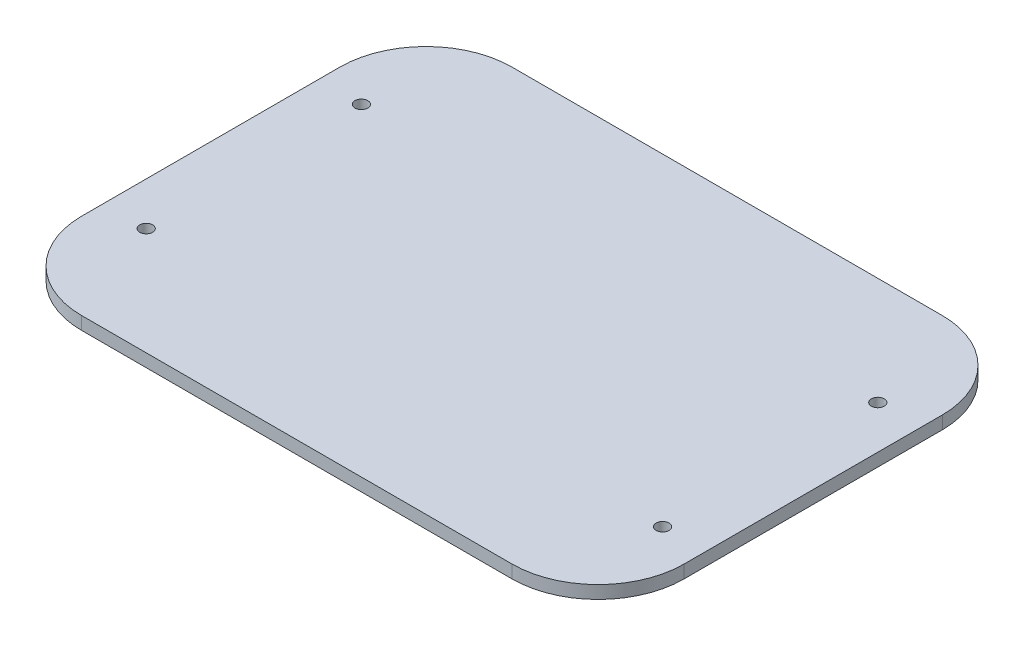
from build123d import *

# Parameters (mm, degrees)
SKETCH_1_W          = 100
SKETCH_1_H          = 100
EXTRUDE_1_DEPTH     = 3
SKETCH_9_W          = 20
SKETCH_9_H          = 100
SKETCH_9_R          = 1.5
EXTRUDE_5_DEPTH     = 3
FILLET_1_R          = 20
EXTRUDE_6_DEPTH     = 7.1
CUT_EXTRUDE_5_DEPTH = 100
SKETCH_12_W         = 3.129471857
SKETCH_12_H         = 20
EXTRUDE_7_DEPTH     = 7.1
CUT_EXTRUDE_6_DEPTH = 100
SKETCH_14_W         = 103.339960755
SKETCH_14_H         = 14.24407727
CUT_EXTRUDE_7_DEPTH = 4
SKETCH_25_W         = 30
SKETCH_25_H         = 1.6
EXTRUDE_13_DEPTH    = 7
SKETCH_26_W         = 30
SKETCH_26_H         = 1.6
EXTRUDE_14_DEPTH    = 7
FILLET_7_R          = 10


with BuildPart() as part:
    # 草图1 → 凸台-拉伸1 (new body)
    with BuildSketch(Plane(origin=(0, 0, 0), x_dir=(1, 0, 0), z_dir=(0, 1, 0))):
        with Locations((50, -50)):
            Rectangle(SKETCH_1_W, SKETCH_1_H)
    extrude(amount=EXTRUDE_1_DEPTH)

    # 草图9 → 凸台-拉伸5 (add)
    # profile 1 of 2: a face of its own
    with BuildSketch(Plane.XZ):
        with Locations((110, 50)):
            Rectangle(SKETCH_9_W, SKETCH_9_H)
        with Locations(Location((110, 75, 0), (0, 0, 270))):
            Circle(SKETCH_9_R, mode=Mode.SUBTRACT)
        with Locations(Location((110, 25, 0), (0, 0, 270))):
            Circle(SKETCH_9_R, mode=Mode.SUBTRACT)
    # profile 2 of 2: a face of its own
    with BuildSketch(Plane.XZ):
        with Locations((-10, 50)):
            Rectangle(SKETCH_9_W, SKETCH_9_H)
        with Locations(Location((-10, 75, 0), (0, 0, 270))):
            Circle(SKETCH_9_R, mode=Mode.SUBTRACT)
        with Locations(Location((-10, 25, 0), (0, 0, 270))):
            Circle(SKETCH_9_R, mode=Mode.SUBTRACT)
    extrude(amount=-EXTRUDE_5_DEPTH)

    # 圆角1
    fillet_1_edges = [part.edges().sort_by_distance(p)[0] for p in [
        (120, 1.5, 100),
        (120, 1.5, 0),
        (-20, 1.5, 0),
        (-20, 1.5, 100),
    ]]
    fillet(fillet_1_edges, radius=FILLET_1_R)

    # 草图10 → 凸台-拉伸6 (add)
    with BuildSketch(Plane.XZ):
        Polygon((7, 50), (7, 0), (12, 0), (12, 100), (7, 100), align=None)
        Polygon((93, 50), (93, 0), (88, 0), (88, 100), (93, 100), align=None)
    extrude(amount=EXTRUDE_6_DEPTH)

    # 草图11 → 切除-拉伸5 (cut)
    with BuildSketch(Plane.XY.offset(100)):
        with BuildLine():
            Line((88, -4.6), (88, -7.1))
            Line((88, -7.1), (90.5, -7.1))
            ThreePointArc((90.5, -7.1), (88.732233047, -6.367766953), (88, -4.6))
        make_face()
        with BuildLine():
            ThreePointArc((93, -4.6), (92.267766953, -6.367766953), (90.5, -7.1))
            Line((90.5, -7.1), (93, -7.1))
            Line((93, -7.1), (93, -4.6))
        make_face()
        with BuildLine():
            ThreePointArc((12, -4.6), (11.267766953, -6.367766953), (9.5, -7.1))
            Line((9.5, -7.1), (12, -7.1))
            Line((12, -7.1), (12, -4.6))
        make_face()
        with BuildLine():
            ThreePointArc((9.5, -7.1), (7.732233047, -6.367766953), (7, -4.6))
            Line((7, -4.6), (7, -7.1))
            Line((7, -7.1), (9.5, -7.1))
        make_face()
    extrude(amount=-CUT_EXTRUDE_5_DEPTH, mode=Mode.SUBTRACT)

    # 草图12 → 凸台-拉伸7 (add)
    with BuildSketch(Plane.XZ):
        with Locations((98.435264072, 90)):
            Rectangle(SKETCH_12_W, SKETCH_12_H)
        with Locations((98.435264072, 10)):
            Rectangle(SKETCH_12_W, SKETCH_12_H)
    extrude(amount=EXTRUDE_7_DEPTH)

    # 草图13 → 切除-拉伸6 (cut)
    with BuildSketch(Plane(origin=(100, 0, 0), x_dir=(0, 0, -1), z_dir=(1, 0, 0))):
        with BuildLine():
            Line((-100, -7.1), (-100, 0))
            ThreePointArc((-100, 0), (-90.611432514, -5.27234511), (-80, -7.1))
            Line((-80, -7.1), (-100, -7.1))
        make_face()
        with BuildLine():
            Line((-20, -7.1), (0, -7.1))
            Line((0, -7.1), (0, 0))
            ThreePointArc((0, 0), (-9.388567486, -5.27234511), (-20, -7.1))
        make_face()
    extrude(amount=-CUT_EXTRUDE_6_DEPTH, mode=Mode.SUBTRACT)

    # 草图14 → 切除-拉伸7 (cut)
    with BuildSketch(Plane(origin=(100, 0, 0), x_dir=(0, 0, -1), z_dir=(1, 0, 0))):
        with Locations((-48.330019622, -7.122038635)):
            Rectangle(SKETCH_14_W, SKETCH_14_H)
    extrude(amount=-CUT_EXTRUDE_7_DEPTH, mode=Mode.SUBTRACT)

    # 草图25 → 凸台-拉伸13 (add)
    with BuildSketch(Plane.ZY.offset(-88)):
        with Locations((65, -3.8)):
            Rectangle(SKETCH_25_W, SKETCH_25_H)
        with Locations((35, -3.8)):
            Rectangle(SKETCH_25_W, SKETCH_25_H)
    extrude(amount=-EXTRUDE_13_DEPTH)

    # 草图26 → 凸台-拉伸14 (add)
    with BuildSketch(Plane(origin=(12, 0, 0), x_dir=(0, 0, -1), z_dir=(1, 0, 0))):
        with Locations((-65, -3.8)):
            Rectangle(SKETCH_26_W, SKETCH_26_H)
        with Locations((-35, -3.8)):
            Rectangle(SKETCH_26_W, SKETCH_26_H)
    extrude(amount=-EXTRUDE_14_DEPTH)

    # 圆角7
    # the kernel refuses this fillet: 10 mm, written as the material it takes off along each edge
    with BuildSketch(Plane(origin=(95, 12, 20), x_dir=(-1, 0, 0), z_dir=(0, -1, 0))) as fillet_7_piece_1_section:
        with BuildLine():
            CenterArc((10, -6), FILLET_7_R, 143.130102354, 36.869897646)
            Line((0, -6), (0, 0))
            Line((0, 0), (2, 0))
        make_face()
    fillet_7_piece_1 = extrude(amount=31.6, mode=Mode.PRIVATE)
    fillet_7_piece_1 = split(fillet_7_piece_1, bisect_by=Plane(origin=(94.505806646, 0, 22.831397785), z_dir=(0, -1, 0)), keep=Keep.TOP, mode=Mode.PRIVATE)
    add(fillet_7_piece_1, mode=Mode.SUBTRACT)
    with BuildSketch(Plane(origin=(95, -19.6, 80), x_dir=(0, 0, -1), z_dir=(0, 1, 0))) as fillet_7_piece_2_section:
        with BuildLine():
            CenterArc((6, 10), FILLET_7_R, 233.130102354, 36.869897646)
            Line((0, 2), (0, 0))
            Line((0, 0), (6, 0))
        make_face()
    fillet_7_piece_2 = extrude(amount=31.6, mode=Mode.PRIVATE)
    fillet_7_piece_2 = split(fillet_7_piece_2, bisect_by=Plane(origin=(94.505806646, 0, 77.168602215), z_dir=(0, -1, 0)), keep=Keep.TOP, mode=Mode.PRIVATE)
    add(fillet_7_piece_2, mode=Mode.SUBTRACT)
    with BuildSketch(Plane(origin=(5, -19.6, 20), x_dir=(0, 0, 1), z_dir=(0, 1, 0))) as fillet_7_piece_3_section:
        with BuildLine():
            CenterArc((6, 10), FILLET_7_R, 233.130102354, 36.869897646)
            Line((0, 2), (0, 0))
            Line((0, 0), (6, 0))
        make_face()
    fillet_7_piece_3 = extrude(amount=31.6, mode=Mode.PRIVATE)
    fillet_7_piece_3 = split(fillet_7_piece_3, bisect_by=Plane(origin=(5.494193354, 0, 22.831397785), z_dir=(0, -1, 0)), keep=Keep.TOP, mode=Mode.PRIVATE)
    add(fillet_7_piece_3, mode=Mode.SUBTRACT)
    with BuildSketch(Plane(origin=(5, 12, 80), x_dir=(1, 0, 0), z_dir=(0, -1, 0))) as fillet_7_piece_4_section:
        with BuildLine():
            CenterArc((10, -6), FILLET_7_R, 143.130102354, 36.869897646)
            Line((0, -6), (0, 0))
            Line((0, 0), (2, 0))
        make_face()
    fillet_7_piece_4 = extrude(amount=31.6, mode=Mode.PRIVATE)
    fillet_7_piece_4 = split(fillet_7_piece_4, bisect_by=Plane(origin=(5.494193354, 0, 77.168602215), z_dir=(0, -1, 0)), keep=Keep.TOP, mode=Mode.PRIVATE)
    add(fillet_7_piece_4, mode=Mode.SUBTRACT)


solid = part.part
